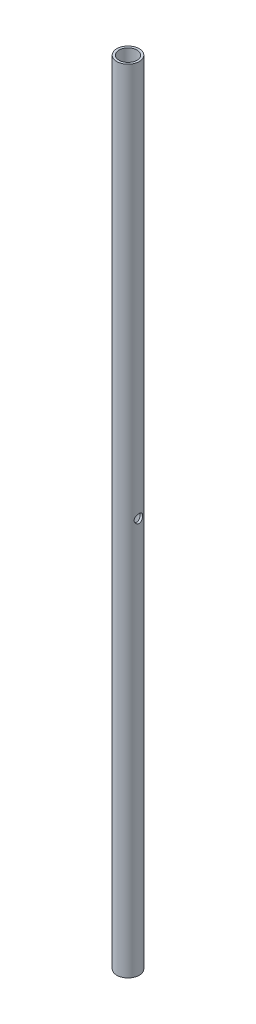
from build123d import *

# Parameters (mm, degrees)
SKETCH1_R               = 16.7005
SKETCH1_R_2             = 13.335
BOSS_EXTRUDE1_DEPTH     = 520.7
BOSS_EXTRUDE2_START     = 660.4
SKETCH3_R               = 16.7005
SKETCH3_R_2             = 13.335
BOSS_EXTRUDE2_DEPTH     = 660.4
CUT_EXTRUDE1_DEPTH      = 661.822194997
CUT_EXTRUDE1_DEPTH_BACK = 661.822194997
SKETCH2_R               = 6.35


with BuildPart() as part:
    # Sketch1 → Boss-Extrude1 (new body)
    with BuildSketch(Plane(origin=(0, 0, 0), x_dir=(1, 0, 0), z_dir=(0, 1, 0))):
        Circle(SKETCH1_R)
        Circle(SKETCH1_R_2, mode=Mode.SUBTRACT)
    extrude(amount=BOSS_EXTRUDE1_DEPTH)

    # Sketch3 → Boss-Extrude2 (add)
    with BuildSketch(Plane.XZ.offset(BOSS_EXTRUDE2_START)):
        Circle(SKETCH3_R)
        Circle(SKETCH3_R_2, mode=Mode.SUBTRACT)
    extrude(amount=-BOSS_EXTRUDE2_DEPTH)

    # Sketch2 → Cut-Extrude1 (cut, two sides: drawn at the far end of the back side and taken through both)
    with BuildSketch(Plane(origin=(0, 0, 0), x_dir=(0, 0, -1), z_dir=(1, 0, 0)).offset(-CUT_EXTRUDE1_DEPTH_BACK)):
        with Locations((0, -69.85)):
            Circle(SKETCH2_R)
    extrude(amount=CUT_EXTRUDE1_DEPTH + CUT_EXTRUDE1_DEPTH_BACK, mode=Mode.SUBTRACT)


solid = part.part
